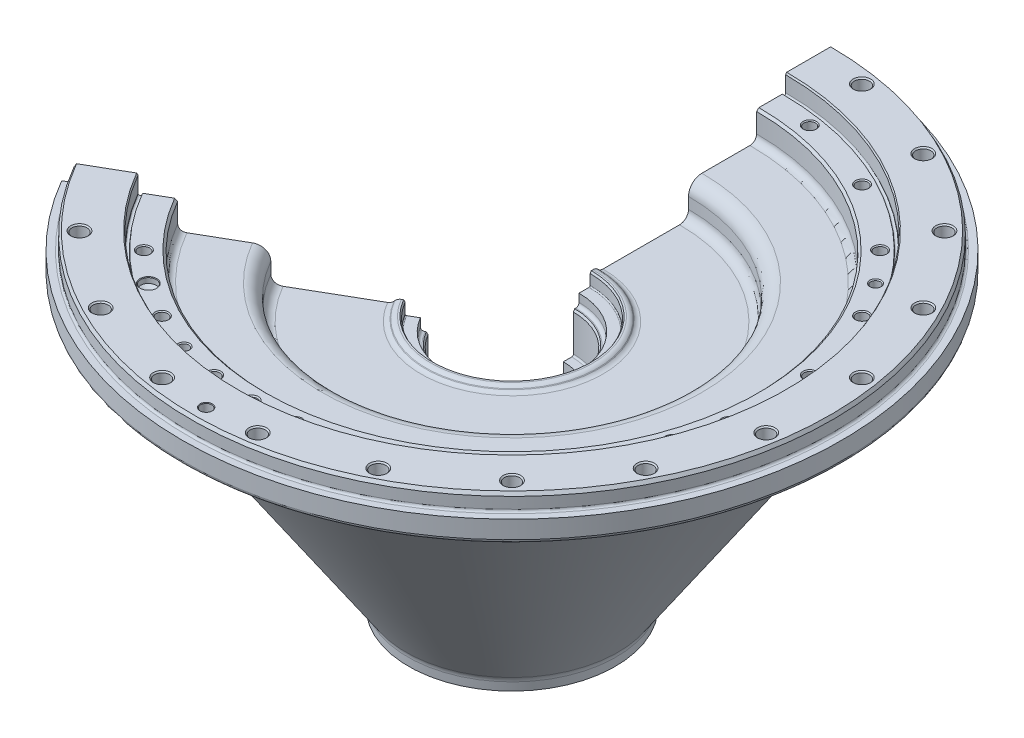
from build123d import *
from build123d.topology import SkipClean

# Parameters (mm, degrees)
SKETCH2_R                               = 56.154701
CUT_EXTRUDE1_DEPTH                      = 2
CUT_EXTRUDE1_DRAFT                      = -30
CUT_EXTRUDE2_START                      = -34
SKETCH3_R                               = 55
CUT_EXTRUDE2_DEPTH                      = 34
SKETCH4_R                               = 60
CUT_EXTRUDE3_DEPTH                      = 59
SKETCH5_R                               = 46
CUT_EXTRUDE4_DEPTH                      = 446.405433
SKETCH6_R                               = 38.5
CUT_EXTRUDE5_DEPTH                      = 4
SKETCH7_R                               = 28.5
CUT_EXTRUDE6_DEPTH                      = 463.008928
SKETCH9_W                               = 61
SKETCH9_H                               = 25.35
M8_CLEARANCE_HOLE1_D                    = 8.4328
M8_CLEARANCE_HOLE1_DEPTH                = 147.616531
M8_CLEARANCE_HOLE1_TIP                  = 2.533469
F_8_5_8_5_DIAMETER_HOLE1_D              = 8.5
F_8_5_8_5_DIAMETER_HOLE1_DEPTH          = 35
F_8_5_8_5_DIAMETER_HOLE1_TIP            = 2.553658
F_13_5_13_5_DIAMETER_HOLE1_D            = 13.5
F_13_5_13_5_DIAMETER_HOLE1_DEPTH        = 295.5
F_13_5_13_5_DIAMETER_HOLE2_D            = 13.5
F_10_0_10_DIAMETER_HOLE1_D              = 10
F_10_0_10_DIAMETER_HOLE1_DEPTH          = 295.5
HOLE1_D                                 = 10.3
HOLE1_DEPTH                             = 38
HOLE1_TIP                               = 3.094432
F_10_0_10_DIAMETER_HOLE2_D              = 10
F_10_0_10_DIAMETER_HOLE2_DEPTH          = 13
F_10_0_10_DIAMETER_HOLE2_TIP            = 3.004303
F_14_0_14_DIAMETER_HOLE1_D              = 14
F_14_0_14_DIAMETER_HOLE1_DEPTH          = 5
F_14_0_14_DIAMETER_HOLE1_TIP            = 4.206024
F_8_5_8_5_DIAMETER_HOLE2_D              = 8.5
F_8_5_8_5_DIAMETER_HOLE2_DEPTH          = 30
F_8_5_8_5_DIAMETER_HOLE2_TIP            = 2.553658
CBORE_FOR_M8_HEX_HEAD_BOLT1_D           = 8.4328
CBORE_FOR_M8_HEX_HEAD_BOLT1_DEPTH       = 119.88113
CBORE_FOR_M8_HEX_HEAD_BOLT1_CBORE_D     = 20
CBORE_FOR_M8_HEX_HEAD_BOLT1_CBORE_DEPTH = 48.868842
CBORE_FOR_M8_HEX_HEAD_BOLT2_D           = 8.4328
CBORE_FOR_M8_HEX_HEAD_BOLT2_DEPTH       = 140.379046
CBORE_FOR_M8_HEX_HEAD_BOLT2_CBORE_D     = 20
CBORE_FOR_M8_HEX_HEAD_BOLT2_CBORE_DEPTH = 83.491712
SKETCH33_W                              = 6
SKETCH33_H                              = 97
CHAMFER1_SIZE2                          = 1.1
CHAMFER1_SIZE                           = 1.1
CHAMFER2_SIZE2                          = 0.85
CHAMFER2_SIZE                           = 0.85
CHAMFER3_SIZE                           = 1
CHAMFER3_SIZE2                          = 1
CHAMFER4_SIZE                           = 1.732051
CHAMFER4_SIZE2                          = 3
CHAMFER5_SIZE                           = 0.5
CHAMFER6_SIZE                           = 1
CHAMFER6_SIZE2                          = 1.732051
CHAMFER7_SIZE                           = 0.433013
CHAMFER7_SIZE2                          = 0.75
CHAMFER8_SIZE                           = 0.866025
CHAMFER8_SIZE2                          = 1.5
CHAMFER9_SIZE                           = 2
CHAMFER9_SIZE2                          = 2
FILLET1_R                               = 1
FILLET2_R                               = 1.5
FILLET3_R                               = 2
FILLET4_R                               = 3
FILLET5_R                               = 6
FILLET6_R                               = 8
FILLET7_R                               = 10
FILLET8_R                               = 12
CUT_EXTRUDE7_DEPTH                      = 512.243826


with BuildPart() as part:
    # Sketch1 → Revolve1 (revolve)
    with BuildSketch(Plane.XY):
        with BuildLine():
            Line((57, -133), (0, -133))
            Line((0, -133), (0, -258))
            Line((0, -258), (53.5, -258))
            ThreePointArc((53.5, -258), (54.56066, -258.43934), (55, -259.5))
            Line((55, -259.5), (55, -308))
            Line((55, -308), (62.5, -308))
            Line((62.5, -308), (62.5, -320))
            Line((62.5, -320), (64, -322.598076))
            Line((64, -322.598076), (64, -333))
            Line((64, -333), (66, -335))
            Line((66, -335), (66, -340))
            Line((66, -340), (73.05, -340))
            Line((73.05, -340), (73.05, -337.5))
            Line((73.05, -337.5), (72.616987, -336.75))
            ThreePointArc((72.616987, -336.75), (72.616987, -336.25), (73.05, -336))
            Line((73.05, -336), (92.5, -336))
            Line((92.5, -336), (93.573185, -325.78933))
            Line((93.573185, -325.78933), (238.337831, -111.24159))
            ThreePointArc((238.337831, -111.24159), (243.02202, -107.507374), (249, -107.120417))
            Line((249, -107.120417), (249, -78.456))
            Line((249, -78.456), (295, -78.456))
            Line((295, -78.456), (295, -59.5))
            Line((295, -59.5), (287, -59.5))
            Line((287, -59.5), (287, -47.5))
            Line((287, -47.5), (285.267949, -44.5))
            Line((285.267949, -44.5), (245, -44.5))
            Line((245, -44.5), (245, -60))
            ThreePointArc((245, -60), (243.5, -61.5), (242, -60))
            Line((242, -60), (242, -59.5))
            Line((242, -59.5), (158, -59.5))
            Line((158, -59.5), (158, -114.85))
            Line((158, -114.85), (70, -114.85))
            Line((70, -114.85), (70, -122.85))
            Line((70, -122.85), (60, -122.85))
            Line((60, -122.85), (60, -130))
            ThreePointArc((60, -130), (59.12132, -132.12132), (57, -133))
        make_face()
    revolve(axis=Axis((0, -44.5, 0), (0, -1, 0)))


with BuildPart() as cut_extrude1_tool:
    # Sketch2 → Cut-Extrude1 (with draft: the straight prism first)
    with BuildSketch(Plane(origin=(0, -133, 0), x_dir=(-1, 0, 0), z_dir=(0, 1, 0))):
        Circle(SKETCH2_R)
    extrude(amount=-CUT_EXTRUDE1_DEPTH)
    # Cut-Extrude1: the draft: its side faces are tilted about the plane it starts from
    cut_extrude1_sides = [cut_extrude1_tool.faces().sort_by_distance(p)[0] for p in [
        (56.154701, -134, 0),
    ]]
    draft(cut_extrude1_sides, Plane(origin=(0, -133, 0), x_dir=(-1, 0, 0), z_dir=(0, 1, 0)), CUT_EXTRUDE1_DRAFT)


with BuildPart() as part_1:
    add(part.part)

    # Cut-Extrude1: cut by cut_extrude1_tool
    add(cut_extrude1_tool.part, mode=Mode.SUBTRACT)

    # Sketch3 → Cut-Extrude2 (cut)
    with BuildSketch(Plane(origin=(0, -135, 0), x_dir=(-1, 0, 0), z_dir=(0, 1, 0)).offset(CUT_EXTRUDE2_START)):
        with Locations(Location((0, 0, 0), (0, 0, 180))):
            Circle(SKETCH3_R)
    extrude(amount=CUT_EXTRUDE2_DEPTH, mode=Mode.SUBTRACT)

    # Sketch4 → Cut-Extrude3 (cut)
    with BuildSketch(Plane.XZ.offset(243)):
        Circle(SKETCH4_R)
    extrude(amount=-CUT_EXTRUDE3_DEPTH, mode=Mode.SUBTRACT)

    # Sketch5 → Cut-Extrude4 (cut, through all)
    with BuildSketch(Plane.XZ.offset(184)):
        Circle(SKETCH5_R)
    extrude(amount=-CUT_EXTRUDE4_DEPTH, mode=Mode.SUBTRACT)

    # Sketch6 → Cut-Extrude5 (cut)
    with BuildSketch(Plane.XZ.offset(258)):
        with Locations(Location((0, 0, 0), (0, 0, 180))):
            Circle(SKETCH6_R)
    extrude(amount=-CUT_EXTRUDE5_DEPTH, mode=Mode.SUBTRACT)

    # Sketch7 → Cut-Extrude6 (cut, through all)
    with BuildSketch(Plane(origin=(0, -243, 0), x_dir=(-1, 0, 0), z_dir=(0, 1, 0))):
        Circle(SKETCH7_R)
    extrude(amount=-CUT_EXTRUDE6_DEPTH, mode=Mode.SUBTRACT)

    # Sketch8 → Cut-Revolve1 (revolve, cut)
    with BuildSketch(Plane.XY):
        with BuildLine():
            Line((161, -117.85), (161, -117.510254))
            ThreePointArc((161, -117.510254), (160.863231, -117.681207), (160.723805, -117.85))
            Line((160.723805, -117.85), (161, -117.85))
        make_face()
    revolve(axis=Axis((0, -117.510254, 0), (0, -1, 0)), mode=Mode.SUBTRACT)

    # Sketch9 → Cut-Revolve2 (revolve, cut)
    with BuildSketch(Plane.XY):
        with Locations((188.5, -72.175)):
            Rectangle(SKETCH9_W, SKETCH9_H)
    revolve(axis=Axis((0, -59.5, 0), (0, -1, 0)), mode=Mode.SUBTRACT)

    # Sketch10 → Revolve2 (revolve)
    with SkipClean():  # the faces are left unmerged after this step: merging them gives an invalid solid
        with BuildSketch(Plane.XY, mode=Mode.PRIVATE) as revolve2_sk:
            Polygon((75, -110.85), (70, -110.85), (70, -114.85), (79, -114.85), align=None)
        revolve(revolve2_sk.sketch.rotate(Axis((0, -110.85, 0), (0, -1, 0)), 270), axis=Axis((0, -110.85, 0), (0, -1, 0)))

    # M8 Clearance Hole1
    with Locations(Plane(origin=(0, -114.85, 0), x_dir=(1, 0, 0), z_dir=(0, 1, 0))):
        with Locations((-79.45364, -32.910775)):
            Hole(M8_CLEARANCE_HOLE1_D / 2, depth=M8_CLEARANCE_HOLE1_DEPTH)
            with Locations((0, 0, -(M8_CLEARANCE_HOLE1_DEPTH + M8_CLEARANCE_HOLE1_TIP / 2))):  # 118° drill point
                Cone(0, M8_CLEARANCE_HOLE1_D / 2, M8_CLEARANCE_HOLE1_TIP, mode=Mode.SUBTRACT)

    # Ø8.5 (8.5) Diameter Hole1
    with Locations(Plane(origin=(0, -336, 0), x_dir=(-1, 0, 0), z_dir=(0, -1, 0))):
        with Locations((-41.275, -71.490397), (41.275, -71.490397), (58.371665, 58.371665), (-58.371665, 58.371665)):
            Hole(F_8_5_8_5_DIAMETER_HOLE1_D / 2, depth=F_8_5_8_5_DIAMETER_HOLE1_DEPTH)
            with Locations((0, 0, -(F_8_5_8_5_DIAMETER_HOLE1_DEPTH + F_8_5_8_5_DIAMETER_HOLE1_TIP / 2))):  # 118° drill point
                Cone(0, F_8_5_8_5_DIAMETER_HOLE1_D / 2, F_8_5_8_5_DIAMETER_HOLE1_TIP, mode=Mode.SUBTRACT)

    # Ø13.5 (13.5) Diameter Hole1
    with Locations(Plane(origin=(0, -44.5, 0), x_dir=(1, 0, 0), z_dir=(0, 1, 0))):
        with Locations((270.379683, 42.823935), (243.913036, -124.279899), (243.913036, 124.279899), (193.570481, -193.570481), (193.570481, 193.570481), (124.279899, -243.913036), (124.279899, 243.913036), (42.823935, -270.379683), (42.823935, 270.379683), (-42.823935, -270.379683), (-42.823935, 270.379683), (-124.279899, -243.913036), (-124.279899, 243.913036), (-193.570481, -193.570481), (-193.570481, 193.570481), (-243.913036, -124.279899), (-243.913036, 124.279899), (-270.379683, -42.823935), (-270.379683, 42.823935)):
            Hole(F_13_5_13_5_DIAMETER_HOLE1_D / 2, depth=F_13_5_13_5_DIAMETER_HOLE1_DEPTH)

    # Ø13.5 (13.5) Diameter Hole2 (through all)
    with Locations(Plane(origin=(0, -78.456, 0), x_dir=(-1, 0, 0), z_dir=(0, -1, 0))):
        with Locations((-270.379683, -42.823935)):
            Hole(F_13_5_13_5_DIAMETER_HOLE2_D / 2)

    # Ø10.0 (10) Diameter Hole1
    with Locations(Plane(origin=(0, -44.5, 0), x_dir=(1, 0, 0), z_dir=(0, 1, 0))):
        with Locations((0, -273.75)):
            Hole(F_10_0_10_DIAMETER_HOLE1_D / 2, depth=F_10_0_10_DIAMETER_HOLE1_DEPTH)

    # Hole1
    with Locations(Plane(origin=(0, -59.5, 0), x_dir=(1, 0, 0), z_dir=(0, 1, 0))):
        with Locations((230.131383, -36.44923), (230.131383, 36.44923), (207.60452, -105.779786), (207.60452, 105.779786), (164.75588, -164.75588), (164.75588, 164.75588), (105.779786, -207.60452), (105.779786, 207.60452), (36.44923, -230.131383), (36.44923, 230.131383), (-36.44923, -230.131383), (-36.44923, 230.131383), (-105.779786, -207.60452), (-105.779786, 207.60452), (-164.75588, -164.75588), (-164.75588, 164.75588), (-207.60452, -105.779786), (-207.60452, 105.779786), (-230.131383, -36.44923), (-230.131383, 36.44923)):
            Hole(HOLE1_D / 2, depth=HOLE1_DEPTH)
            with Locations((0, 0, -(HOLE1_DEPTH + HOLE1_TIP / 2))):  # 118° drill point
                Cone(0, HOLE1_D / 2, HOLE1_TIP, mode=Mode.SUBTRACT)

    # Ø10.0 (10) Diameter Hole2
    with Locations(Plane(origin=(0, -59.5, 0), x_dir=(1, 0, 0), z_dir=(0, 1, 0))):
        with Locations((0, -233)):
            Hole(F_10_0_10_DIAMETER_HOLE2_D / 2, depth=F_10_0_10_DIAMETER_HOLE2_DEPTH)
            with Locations((0, 0, -(F_10_0_10_DIAMETER_HOLE2_DEPTH + F_10_0_10_DIAMETER_HOLE2_TIP / 2))):  # 118° drill point
                Cone(0, F_10_0_10_DIAMETER_HOLE2_D / 2, F_10_0_10_DIAMETER_HOLE2_TIP, mode=Mode.SUBTRACT)

    # Ø14.0 (14) Diameter Hole1
    with Locations(Plane(origin=(0, -59.5, 0), x_dir=(1, 0, 0), z_dir=(0, 1, 0))):
        with Locations((220.305828, -75.85738), (-54.39277, 226.562191), (-136.953964, -188.50096)):
            Hole(F_14_0_14_DIAMETER_HOLE1_D / 2, depth=F_14_0_14_DIAMETER_HOLE1_DEPTH)
            with Locations((0, 0, -(F_14_0_14_DIAMETER_HOLE1_DEPTH + F_14_0_14_DIAMETER_HOLE1_TIP / 2))):  # 118° drill point
                Cone(0, F_14_0_14_DIAMETER_HOLE1_D / 2, F_14_0_14_DIAMETER_HOLE1_TIP, mode=Mode.SUBTRACT)

    # Ø8.5 (8.5) Diameter Hole2
    with Locations(Plane(origin=(0, -59.5, 0), x_dir=(1, 0, 0), z_dir=(0, 1, 0))):
        with Locations((188.50096, -136.953964), (188.50096, 136.953964), (-72.00096, -221.596168), (-72.00096, 221.596168), (-233, 0)):
            Hole(F_8_5_8_5_DIAMETER_HOLE2_D / 2, depth=F_8_5_8_5_DIAMETER_HOLE2_DEPTH)
            with Locations((0, 0, -(F_8_5_8_5_DIAMETER_HOLE2_DEPTH + F_8_5_8_5_DIAMETER_HOLE2_TIP / 2))):  # 118° drill point
                Cone(0, F_8_5_8_5_DIAMETER_HOLE2_D / 2, F_8_5_8_5_DIAMETER_HOLE2_TIP, mode=Mode.SUBTRACT)

    # CBORE for M8 Hex Head Bolt1
    with Locations(Plane(origin=(-136.812925, 0, 56.669769), x_dir=(0.3826834323650899, 0, 0.9238795325112867), z_dir=(-0.9238795325112867, 0, 0.3826834323650899))):
        with Locations((0, -255)):
            CounterBoreHole(CBORE_FOR_M8_HEX_HEAD_BOLT1_D / 2, CBORE_FOR_M8_HEX_HEAD_BOLT1_CBORE_D / 2, CBORE_FOR_M8_HEX_HEAD_BOLT1_CBORE_DEPTH, depth=CBORE_FOR_M8_HEX_HEAD_BOLT1_DEPTH)

    # CBORE for M8 Hex Head Bolt2
    with Locations(Plane(origin=(-204.260718, -127.646491, 84.60756), x_dir=(0.28104832556833637, 0.17563255891285848, 0.9434855817366558), z_dir=(-0.8001031451912655, -0.5000000000000004, 0.3314135740355912))):
        with Locations((-16.883995, -81.523138)):
            CounterBoreHole(CBORE_FOR_M8_HEX_HEAD_BOLT2_D / 2, CBORE_FOR_M8_HEX_HEAD_BOLT2_CBORE_D / 2, CBORE_FOR_M8_HEX_HEAD_BOLT2_CBORE_DEPTH, depth=CBORE_FOR_M8_HEX_HEAD_BOLT2_DEPTH)

    # Sketch33 → Ø12.0 (12) Diameter Hole1 (revolve, cut)
    with SkipClean():  # the faces are left unmerged after this step: merging them gives an invalid solid
        with BuildSketch(Plane(origin=(54, -243, 0), x_dir=(0, 0, 1), z_dir=(1, 0, 0))):
            with Locations((3, 48.5)):
                Rectangle(SKETCH33_W, SKETCH33_H)
        revolve(axis=Axis((54, -236.65, 0), (0, -1, 0)), mode=Mode.SUBTRACT)

    # Chamfer1
    chamfer1_edges = [part_1.edges().sort_by_distance(p)[0] for p in [
        (-263.629683, -78.456, -42.823935),
        (-263.629683, -44.5, -42.823935),
        (-263.629683, -78.456, 42.823935),
        (-263.629683, -44.5, 42.823935),
        (-237.163036, -78.456, -124.279899),
        (-237.163036, -44.5, -124.279899),
        (-237.163036, -78.456, 124.279899),
        (-237.163036, -44.5, 124.279899),
        (-186.820481, -78.456, -193.570481),
        (-186.820481, -44.5, -193.570481),
        (-186.820481, -78.456, 193.570481),
        (-186.820481, -44.5, 193.570481),
        (-117.529899, -78.456, -243.913036),
        (-117.529899, -44.5, -243.913036),
        (-117.529899, -78.456, 243.913036),
        (-117.529899, -44.5, 243.913036),
        (-36.073935, -78.456, -270.379683),
        (-36.073935, -44.5, -270.379683),
        (-36.073935, -78.456, 270.379683),
        (-36.073935, -44.5, 270.379683),
        (49.573935, -78.456, -270.379683),
        (49.573935, -44.5, -270.379683),
        (49.573935, -78.456, 270.379683),
        (49.573935, -44.5, 270.379683),
        (131.029899, -78.456, -243.913036),
        (131.029899, -44.5, -243.913036),
        (131.029899, -78.456, 243.913036),
        (131.029899, -44.5, 243.913036),
        (200.320481, -78.456, -193.570481),
        (200.320481, -44.5, -193.570481),
        (200.320481, -78.456, 193.570481),
        (200.320481, -44.5, 193.570481),
        (250.663036, -78.456, -124.279899),
        (250.663036, -44.5, -124.279899),
        (250.663036, -78.456, 124.279899),
        (250.663036, -44.5, 124.279899),
        (277.129683, -78.456, -42.823935),
        (277.129683, -44.5, -42.823935),
        (263.629683, -78.456, 42.823935),
        (263.629683, -44.5, 42.823935),
    ]]
    chamfer(chamfer1_edges, length=CHAMFER1_SIZE, length2=CHAMFER1_SIZE2)

    # Chamfer2
    chamfer2_edges = [part_1.edges().sort_by_distance(p)[0] for p in [
        (54.121665, -336, -58.371665),
        (-62.621665, -336, -58.371665),
        (-45.525, -336, 71.490397),
        (37.025, -336, 71.490397),
        (-224.981383, -59.5, -36.44923),
        (-224.981383, -59.5, 36.44923),
        (-202.45452, -59.5, -105.779786),
        (-202.45452, -59.5, 105.779786),
        (-159.60588, -59.5, -164.75588),
        (-159.60588, -59.5, 164.75588),
        (-100.629786, -59.5, -207.60452),
        (-100.629786, -59.5, 207.60452),
        (-31.29923, -59.5, -230.131383),
        (-31.29923, -59.5, 230.131383),
        (41.59923, -59.5, -230.131383),
        (41.59923, -59.5, 230.131383),
        (110.929786, -59.5, -207.60452),
        (110.929786, -59.5, 207.60452),
        (169.90588, -59.5, -164.75588),
        (169.90588, -59.5, 164.75588),
        (212.75452, -59.5, -105.779786),
        (212.75452, -59.5, 105.779786),
        (235.281383, -59.5, -36.44923),
        (235.281383, -59.5, 36.44923),
        (-228.75, -59.5, 0),
        (-67.75096, -59.5, -221.596168),
        (-67.75096, -59.5, 221.596168),
        (192.75096, -59.5, -136.953964),
        (192.75096, -59.5, 136.953964),
    ]]
    chamfer(chamfer2_edges, length=CHAMFER2_SIZE, length2=CHAMFER2_SIZE2)

    # Chamfer3
    chamfer3_edges = [part_1.edges().sort_by_distance(p)[0] for p in [
        (5, -59.5, 233),
    ]]
    chamfer3_side = [part_1.faces().sort_by_distance(p)[0] for p in [
        (-217.28659, -59.5, -36.44923),
    ]]
    chamfer(chamfer3_edges, length=CHAMFER3_SIZE, length2=CHAMFER3_SIZE2, reference=chamfer3_side[0])

    # Chamfer4
    chamfer4_edges = [part_1.edges().sort_by_distance(p)[0] for p in [
        (-55, -308, 0),
    ]]
    chamfer4_side = [part_1.faces().sort_by_distance(p)[0] for p in [
        (-60.732233, -308, 0),
    ]]
    chamfer(chamfer4_edges, length=CHAMFER4_SIZE, length2=CHAMFER4_SIZE2, reference=chamfer4_side[0])

    # Chamfer5
    chamfer5_edges = [part_1.edges().sort_by_distance(p)[0] for p in [
        (5, -78.456, 273.75),
        (5, -44.5, 273.75),
        (-129.953964, -59.5, 188.50096),
        (-47.39277, -59.5, -226.562191),
        (227.305828, -59.5, 75.85738),
    ]]
    chamfer(chamfer5_edges, length=CHAMFER5_SIZE)

    # Chamfer6
    chamfer6_edges = [part_1.edges().sort_by_distance(p)[0] for p in [
        (0, -110.85, 70),
    ]]
    chamfer6_side = [part_1.faces().sort_by_distance(p)[0] for p in [
        (0, -110.85, 72.87868),
    ]]
    chamfer(chamfer6_edges, length=CHAMFER6_SIZE, length2=CHAMFER6_SIZE2, reference=chamfer6_side[0])

    # Chamfer7
    chamfer7_edges = [part_1.edges().sort_by_distance(p)[0] for p in [
        (-73.05, -340, 0),
    ]]
    chamfer7_side = [part_1.faces().sort_by_distance(p)[0] for p in [
        (-68.066166, -340, 0),
    ]]
    chamfer(chamfer7_edges, length=CHAMFER7_SIZE, length2=CHAMFER7_SIZE2, reference=chamfer7_side[0])

    # Chamfer8
    chamfer8_edges = [part_1.edges().sort_by_distance(p)[0] for p in [
        (-245, -44.5, 0),
    ]]
    chamfer8_side = [part_1.faces().sort_by_distance(p)[0] for p in [
        (13.568596, -44.5, 273.75),
    ]]
    chamfer(chamfer8_edges, length=CHAMFER8_SIZE, length2=CHAMFER8_SIZE2, reference=chamfer8_side[0])

    # Chamfer9
    chamfer9_edges = [part_1.edges().sort_by_distance(p)[0] for p in [
        (-219, -59.5, 0),
    ]]
    chamfer9_side = [part_1.faces().sort_by_distance(p)[0] for p in [
        (-122.60917, -59.5, 188.50096),
    ]]
    chamfer(chamfer9_edges, length=CHAMFER9_SIZE, length2=CHAMFER9_SIZE2, reference=chamfer9_side[0])

    # Fillet1
    fillet1_edges = [part_1.edges().sort_by_distance(p)[0] for p in [
        (-70, -122.85, 0),
    ]]
    fillet(fillet1_edges, radius=FILLET1_R)

    # Fillet2
    fillet2_edges = [part_1.edges().sort_by_distance(p)[0] for p in [
        (-62.5, -308, 0),
        (-55, -169, 0),
    ]]
    fillet(fillet2_edges, radius=FILLET2_R)

    # Fillet3
    fillet3_edges = [part_1.edges().sort_by_distance(p)[0] for p in [
        (-287, -59.5, 0),
    ]]
    fillet(fillet3_edges, radius=FILLET3_R)

    # Fillet4
    fillet4_edges = [part_1.edges().sort_by_distance(p)[0] for p in [
        (-249, -107.120417, 0),
        (-295, -78.456, 0),
    ]]
    fillet(fillet4_edges, radius=FILLET4_R)

    # Fillet5
    fillet5_edges = [part_1.edges().sort_by_distance(p)[0] for p in [
        (-219, -84.85, 0),
        (0, -114.85, 79),
        (0, -110.85, 75),
    ]]
    fillet(fillet5_edges, radius=FILLET5_R)

    # Fillet6
    fillet6_edges = [part_1.edges().sort_by_distance(p)[0] for p in [
        (-158, -114.85, 0),
    ]]
    fillet(fillet6_edges, radius=FILLET6_R)

    # Fillet7
    # the kernel refuses this fillet: 10 mm, written as the material it adds along each edge
    with BuildSketch(Plane(origin=(0, -325.78933, 0), x_dir=(1, 0, 0), z_dir=(0, 0, -1))) as fillet7_piece_1:
        with BuildLine():
            CenterArc((93.573185 + FILLET7_R * 0.968451065937, FILLET7_R * 0.352575836389), FILLET7_R, 186, 28.009244)
            Line((93.573185 - FILLET7_R * 0.0260708294441, FILLET7_R * 0.248047373241), (93.573185, 0))
            Line((93.573185, 0), (93.573185 + FILLET7_R * 0.13950372233, -FILLET7_R * 0.206750813724))
        make_face()
    revolve(axis=Axis((0, -325.78933, 0), (0, -1, 0)))
    with BuildSketch(Plane(origin=(0, -78.456, 0), x_dir=(1, 0, 0), z_dir=(0, 0, -1))) as fillet7_piece_2:
        with BuildLine():
            CenterArc((249 + FILLET7_R, FILLET7_R), FILLET7_R, 180, 90)
            Line((249 + FILLET7_R, 0), (249, 0))
            Line((249, 0), (249, FILLET7_R))
        make_face()
    revolve(axis=Axis((0, -78.456, 0), (0, -1, 0)))
    with BuildSketch(Plane(origin=(0, -243, 0), x_dir=(1, 0, 0), z_dir=(0, 0, -1))) as fillet7_piece_3_section:
        with BuildLine():
            CenterArc((60 - FILLET7_R, -FILLET7_R), FILLET7_R, 0, 90)
            Line((60, -FILLET7_R), (60, 0))
            Line((60, 0), (60 - FILLET7_R, 0))
        make_face()
    fillet7_piece_3 = revolve(axis=Axis((0, -243, 0), (0, -1, 0)), mode=Mode.PRIVATE)
    fillet7_piece_3 = fillet7_piece_3 - Plane(origin=(54, -240.218445, 0), x_dir=(0, 0, 1), z_dir=(0, 1, 0)) * Cylinder(6, 240, mode=Mode.PRIVATE)
    add(fillet7_piece_3)
    with BuildSketch(Plane(origin=(0, -184, 0), x_dir=(1, 0, 0), z_dir=(0, 0, -1))) as fillet7_piece_4:
        with BuildLine():
            CenterArc((60 - FILLET7_R, FILLET7_R), FILLET7_R, 270, 90)
            Line((60 - FILLET7_R, 0), (60, 0))
            Line((60, 0), (60, FILLET7_R))
        make_face()
    revolve(axis=Axis((0, -184, 0), (0, -1, 0)))

    # Fillet8
    fillet8_edges = [part_1.edges().sort_by_distance(p)[0] for p in [
        (-158, -84.85, 0),
    ]]
    fillet(fillet8_edges, radius=FILLET8_R)

    # Sketch35 → Cut-Extrude7 (cut, through all)
    with BuildSketch(Plane(origin=(0, -44.5, 0), x_dir=(1, 0, 0), z_dir=(0, 1, 0))):
        Polygon((0, 0), (-466.860118, -270.16298), (-310.247015, 316.665459), (27.897828, 402.138011), (0, 285.267949), align=None)
    extrude(amount=-CUT_EXTRUDE7_DEPTH, mode=Mode.SUBTRACT)


solid = part_1.part
